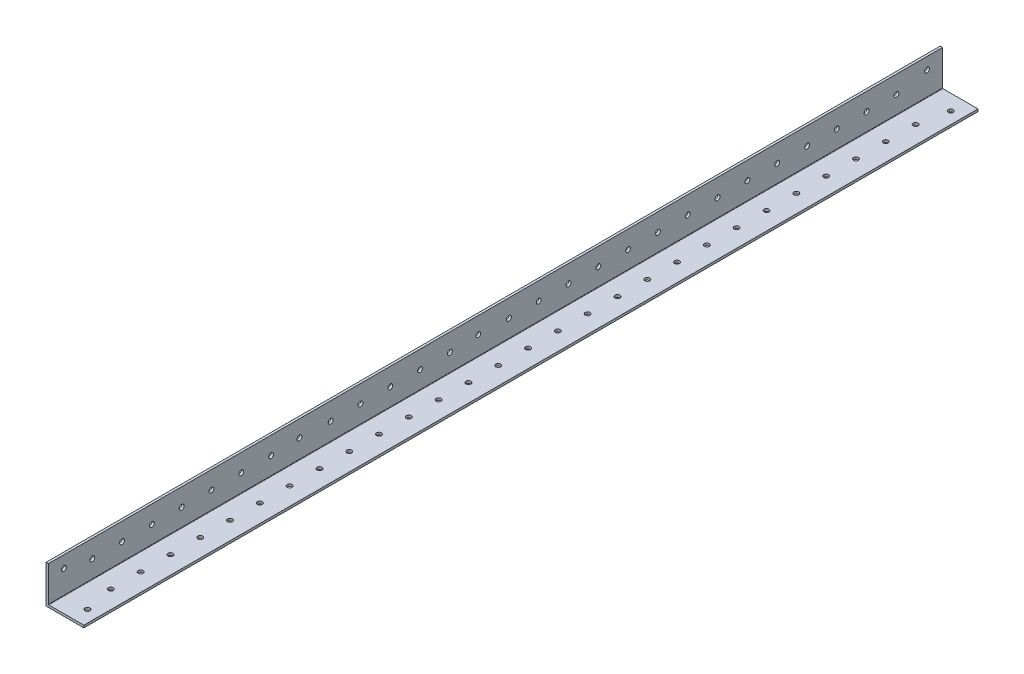
from build123d import *

# Parameters (mm, degrees)
BOSS_EXTRUDE1_DEPTH = 1219.2
FILLET1_R           = 0.254
SKETCH4_W           = 1838.4
SKETCH4_H           = 74.945320812
CUT_EXTRUDE1_DEPTH  = 60
SKETCH5_R           = 1.65
CUT_EXTRUDE2_DEPTH  = 10
SKETCH9_R           = 1.65
CUT_EXTRUDE6_DEPTH  = 60


with BuildPart() as part:
    # Sketch3 → Boss-Extrude1 (new, symmetric)
    with BuildSketch(Plane.XY):
        Polygon((1.5875, 25.4), (0, 25.4), (0, 0), (25.4, 0), (25.4, 1.5875), (1.5875, 1.5875), align=None)
    extrude(amount=BOSS_EXTRUDE1_DEPTH, both=True)

    # Fillet1
    fillet1_edges = [part.edges().sort_by_distance(p)[0] for p in [
        (1.5875, 1.5875, 0),
    ]]
    fillet(fillet1_edges, radius=FILLET1_R)

    # Sketch4 → Cut-Extrude1 (cut)
    with BuildSketch(Plane.ZY):
        with Locations((-300, 37.472660406)):
            Rectangle(SKETCH4_W, SKETCH4_H)
    extrude(amount=-CUT_EXTRUDE1_DEPTH, mode=Mode.SUBTRACT)

    # Sketch5 → Cut-Extrude2 (cut)
    with BuildSketch(Plane(origin=(0, 1.5875, 0), x_dir=(1, 0, 0), z_dir=(0, 1, 0))):
        with Locations((17.4625, -629.5759)):
            Circle(SKETCH5_R)
        with Locations((17.4625, -1208.8241)):
            Circle(SKETCH5_R)
        with Locations((13.49375, -1189.2)):
            Circle(SKETCH5_R)
        with Locations((13.49375, -1169.2)):
            Circle(SKETCH5_R)
        with Locations((13.49375, -1149.2)):
            Circle(SKETCH5_R)
        with Locations((13.49375, -1129.2)):
            Circle(SKETCH5_R)
        with Locations((13.49375, -1109.2)):
            Circle(SKETCH5_R)
        with Locations((13.49375, -1089.2)):
            Circle(SKETCH5_R)
        with Locations((13.49375, -1069.2)):
            Circle(SKETCH5_R)
        with Locations((13.49375, -1049.2)):
            Circle(SKETCH5_R)
        with Locations((13.49375, -1029.2)):
            Circle(SKETCH5_R)
        with Locations((13.49375, -1009.2)):
            Circle(SKETCH5_R)
        with Locations((13.49375, -989.2)):
            Circle(SKETCH5_R)
        with Locations((13.49375, -969.2)):
            Circle(SKETCH5_R)
        with Locations((13.49375, -949.2)):
            Circle(SKETCH5_R)
        with Locations((13.49375, -929.2)):
            Circle(SKETCH5_R)
        with Locations((13.49375, -909.2)):
            Circle(SKETCH5_R)
        with Locations((13.49375, -889.2)):
            Circle(SKETCH5_R)
        with Locations((13.49375, -869.2)):
            Circle(SKETCH5_R)
        with Locations((13.49375, -849.2)):
            Circle(SKETCH5_R)
        with Locations((13.49375, -829.2)):
            Circle(SKETCH5_R)
        with Locations((13.49375, -809.2)):
            Circle(SKETCH5_R)
        with Locations((13.49375, -789.2)):
            Circle(SKETCH5_R)
        with Locations((13.49375, -769.2)):
            Circle(SKETCH5_R)
        with Locations((13.49375, -749.2)):
            Circle(SKETCH5_R)
        with Locations((13.49375, -729.2)):
            Circle(SKETCH5_R)
        with Locations((13.49375, -709.2)):
            Circle(SKETCH5_R)
        with Locations((13.49375, -689.2)):
            Circle(SKETCH5_R)
        with Locations((13.49375, -669.2)):
            Circle(SKETCH5_R)
        with Locations((13.49375, -649.2)):
            Circle(SKETCH5_R)
    extrude(amount=-CUT_EXTRUDE2_DEPTH, mode=Mode.SUBTRACT)

    # Sketch9 → Cut-Extrude6 (cut)
    with BuildSketch(Plane(origin=(1.5875, 0, 0), x_dir=(0, 0, -1), z_dir=(1, 0, 0))):
        with Locations((-629.5759, 17.4625)):
            Circle(SKETCH9_R)
        with Locations((-1208.8241, 17.4625)):
            Circle(SKETCH9_R)
        with Locations((-1050.70625, 14.2875)):
            Circle(SKETCH9_R)
        with Locations((-930.70625, 14.2875)):
            Circle(SKETCH9_R)
        with Locations((-1189.765175, 13.49375)):
            Circle(SKETCH9_R)
        with Locations((-1169.765175, 13.49375)):
            Circle(SKETCH9_R)
        with Locations((-1149.765175, 13.49375)):
            Circle(SKETCH9_R)
        with Locations((-1129.765175, 13.49375)):
            Circle(SKETCH9_R)
        with Locations((-1109.765175, 13.49375)):
            Circle(SKETCH9_R)
        with Locations((-1089.765175, 13.49375)):
            Circle(SKETCH9_R)
        with Locations((-1069.765175, 13.49375)):
            Circle(SKETCH9_R)
        with Locations((-1029.765175, 13.49375)):
            Circle(SKETCH9_R)
        with Locations((-1009.765175, 13.49375)):
            Circle(SKETCH9_R)
        with Locations((-989.765175, 13.49375)):
            Circle(SKETCH9_R)
        with Locations((-969.765175, 13.49375)):
            Circle(SKETCH9_R)
        with Locations((-949.765175, 13.49375)):
            Circle(SKETCH9_R)
        with Locations((-650.141075, 13.49375)):
            Circle(SKETCH9_R)
        with Locations((-670.141075, 13.49375)):
            Circle(SKETCH9_R)
        with Locations((-690.141075, 13.49375)):
            Circle(SKETCH9_R)
        with Locations((-710.141075, 13.49375)):
            Circle(SKETCH9_R)
        with Locations((-730.141075, 13.49375)):
            Circle(SKETCH9_R)
        with Locations((-750.141075, 13.49375)):
            Circle(SKETCH9_R)
        with Locations((-770.141075, 13.49375)):
            Circle(SKETCH9_R)
        with Locations((-790.141075, 13.49375)):
            Circle(SKETCH9_R)
        with Locations((-810.141075, 13.49375)):
            Circle(SKETCH9_R)
        with Locations((-830.141075, 13.49375)):
            Circle(SKETCH9_R)
        with Locations((-850.141075, 13.49375)):
            Circle(SKETCH9_R)
        with Locations((-870.141075, 13.49375)):
            Circle(SKETCH9_R)
        with Locations((-890.141075, 13.49375)):
            Circle(SKETCH9_R)
        with Locations((-910.141075, 13.49375)):
            Circle(SKETCH9_R)
    extrude(amount=-CUT_EXTRUDE6_DEPTH, mode=Mode.SUBTRACT)


solid = part.part
